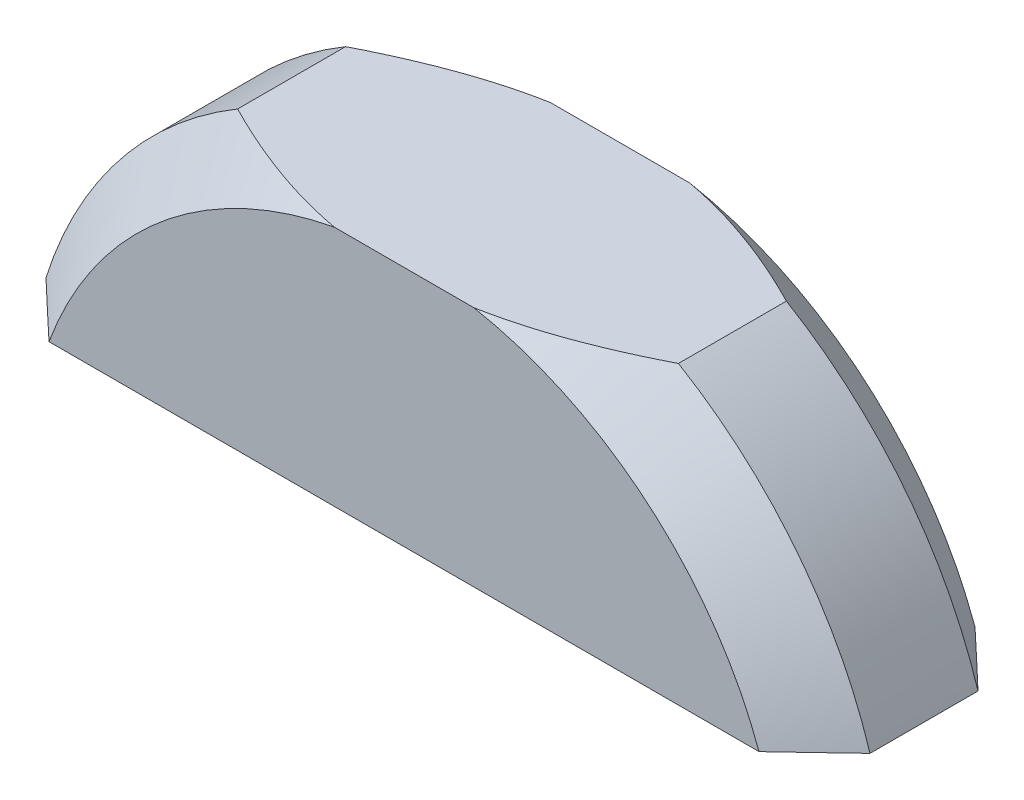
from build123d import *

# Parameters (mm, degrees)
EXTRUDE1_DEPTH = 1
CHAMFER1_SIZE  = 0.25


with BuildPart() as part:
    # body → Extrude1 (new body)
    with BuildSketch(Plane.XY):
        with BuildLine():
            Line((-1.907878403, 0.6), (1.907878403, 0.6))
            ThreePointArc((1.907878403, 0.6), (1.567666726, 1.241942445), (1.020588066, 1.72))
            Line((1.020588066, 1.72), (-1.020588066, 1.72))
            ThreePointArc((-1.020588066, 1.72), (-1.567666726, 1.241942445), (-1.907878403, 0.6))
        make_face()
    extrude(amount=EXTRUDE1_DEPTH)

    # Chamfer1
    chamfer1_edges = [part.edges().sort_by_distance(p)[0] for p in [
        (-1.567666726, 1.241942445, 0),
        (1.567666726, 1.241942445, 0),
        (1.567666726, 1.241942445, 1),
        (-1.567666726, 1.241942445, 1),
    ]]
    chamfer(chamfer1_edges, length=CHAMFER1_SIZE)


solid = part.part
